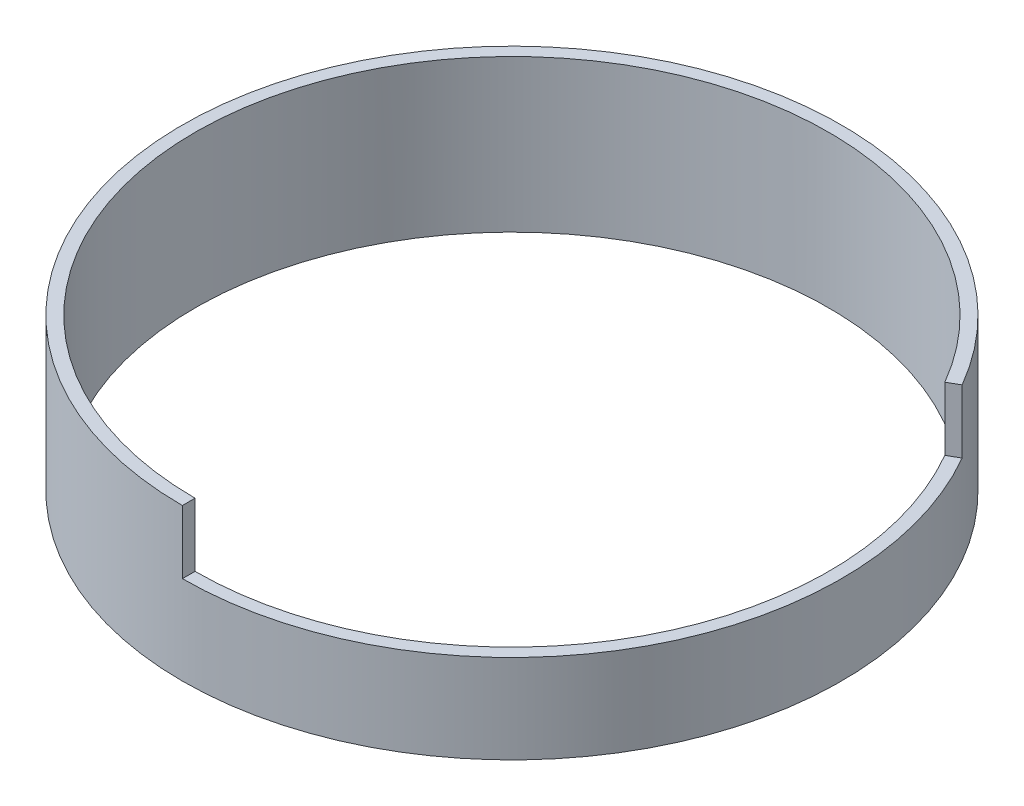
from build123d import *

# Parameters (mm, degrees)
BOSS_EXTRUDE1_DEPTH = 38.1
BOSS_EXTRUDE2_DEPTH = 22.225


with BuildPart() as part:
    # Sketch1 → Boss-Extrude1 (new body)
    with BuildSketch(Plane(origin=(0, 0, 0), x_dir=(1, 0, 0), z_dir=(0, 1, 0))):
        with BuildLine():
            Line((0, -82.55), (0, -79.375))
            ThreePointArc((0, -79.375), (-68.740766425, 39.6875), (68.740766425, 39.6875))
            Line((68.740766425, 39.6875), (71.490397082, 41.275))
            ThreePointArc((71.490397082, 41.275), (-71.490397082, 41.275), (0, -82.55))
        make_face()
    extrude(amount=BOSS_EXTRUDE1_DEPTH)

    # Sketch1<3> → Boss-Extrude2 (add)
    with BuildSketch(Plane(origin=(0, 0, 0), x_dir=(1, 0, 0), z_dir=(0, 1, 0))):
        with BuildLine():
            ThreePointArc((79.375, 0), (56.126600757, -56.126600757), (0, -79.375))
            Line((0, -79.375), (0, -82.55))
            ThreePointArc((0, -82.55), (58.371664787, -58.371664787), (82.55, 0))
            ThreePointArc((82.55, 0), (79.73717696, 21.365512173), (71.490397082, 41.275))
            Line((71.490397082, 41.275), (68.740766425, 39.6875))
            ThreePointArc((68.740766425, 39.6875), (76.670362462, 20.543761705), (79.375, 0))
        make_face()
    extrude(amount=BOSS_EXTRUDE2_DEPTH)


solid = part.part
